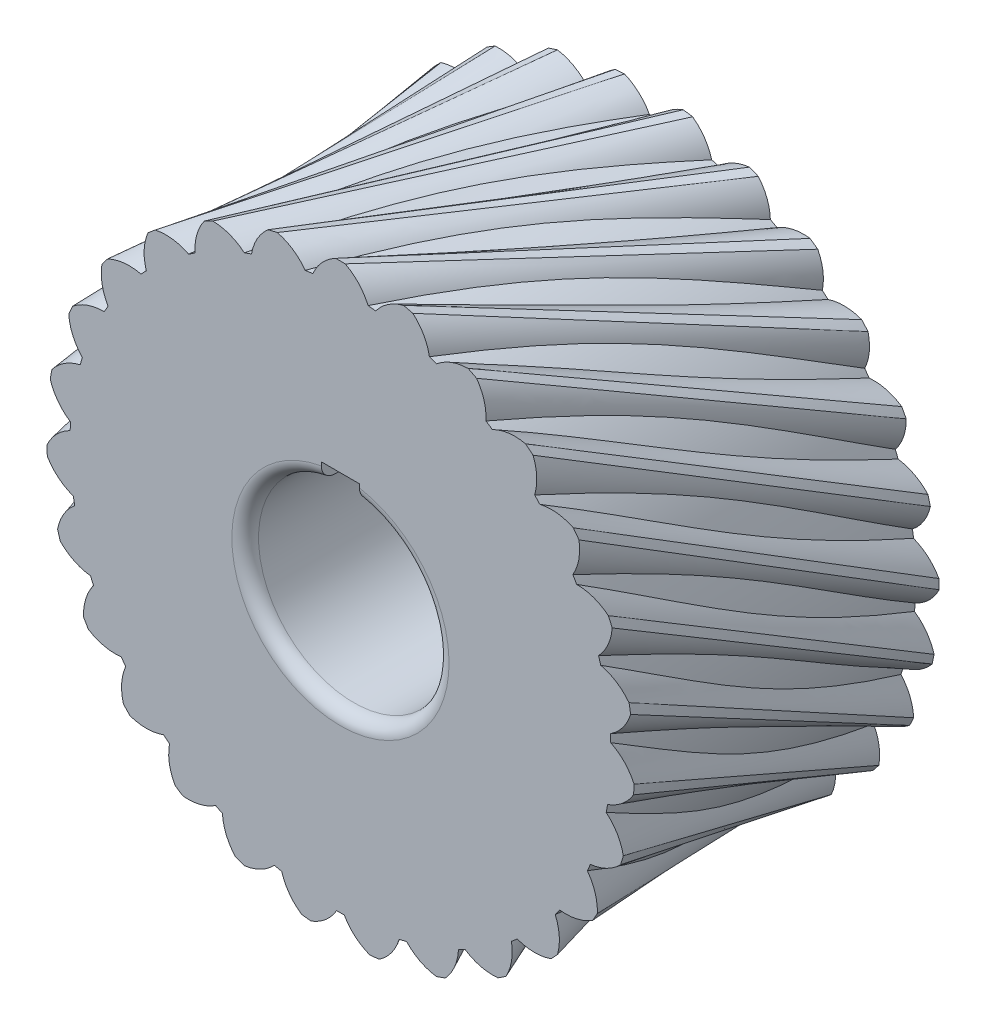
from build123d import *

# Parameters (mm, degrees)
ESQUISSE5_R                  = 14.2
ESQUISSE5_R_2                = 5
EXTRUSION1_DEPTH             = 16
R_P_TITION_CIRCULAIRE2_COUNT = 27
ESQUISSE7_W                  = 2
ESQUISSE7_H                  = 2.243921676
ENL_V_MAT_EXTRU_1_DEPTH      = 28.051779314
CONG_1_R                     = 0.7
CHANFREIN1_SIZE              = 0.5


with BuildPart() as part:
    # Esquisse5 → Extrusion1 (new body)
    with BuildSketch(Plane.XY):
        Circle(ESQUISSE5_R)
        Circle(ESQUISSE5_R_2, mode=Mode.SUBTRACT)
    extrude(amount=-EXTRUSION1_DEPTH)

    # Esquisse1 for Lissage3 → Lissage3 section 0
    with BuildSketch(Plane.XY):
        with BuildLine():
            # circular arc as an exact rational Bezier (weights 1, cos(half-angle), 1)
            Bezier((-0.25, 15.422600681), (0, 15.426653176), (0.25, 15.422600681), weights=[1, 0.999868644, 1])
            Bezier((0.25, 15.422600681), (1.08257531, 14.989397783), (1.45, 14.125774315), weights=[1, 0.941281609, 1])
            Bezier((1.45, 14.125774315), (0, 14.274615713), (-1.45, 14.125774315), weights=[1, 0.994772839, 1])
            Bezier((-1.45, 14.125774315), (-1.08257531, 14.989397783), (-0.25, 15.422600681), weights=[1, 0.941281609, 1])
        make_face()
    # Esquisse6 for Lissage3 → Lissage3 section 1
    with BuildSketch(Plane(origin=(0, 0, -16), x_dir=(-1, 0, 0), z_dir=(0, 0, -1))):
        with BuildLine():
            Bezier((-8.641252327, 12.776848985), (-8.848364753, 12.636774485), (-9.050828349, 12.490060767), weights=[1, 0.999868644, 1])
            Bezier((-9.050828349, 12.490060767), (-9.484359141, 11.657656148), (-9.289981757, 10.739471075), weights=[1, 0.941281609, 1])
            Bezier((-9.289981757, 10.739471075), (-8.187583211, 11.693080643), (-6.914440828, 12.40284274), weights=[1, 0.994772839, 1])
            Bezier((-6.914440828, 12.40284274), (-7.710771585, 12.899535525), (-8.641252327, 12.776848985), weights=[1, 0.941281609, 1])
        make_face()
    lissage3 = loft()

    # Répétition circulaire2: Lissage3 ×27 about axis
    r_p_tition_circulaire2_axis = Axis((0, 0, -16), (0, 0, 1))
    for i in range(1, R_P_TITION_CIRCULAIRE2_COUNT):
        add(lissage3.rotate(r_p_tition_circulaire2_axis, i * 360 / R_P_TITION_CIRCULAIRE2_COUNT))

    # Esquisse7 → Enlèv. mat.-Extru.1 (cut, through all)
    with BuildSketch(Plane.XY):
        with Locations((0, 4.678039162)):
            Rectangle(ESQUISSE7_W, ESQUISSE7_H)
    extrude(amount=-ENL_V_MAT_EXTRU_1_DEPTH, mode=Mode.SUBTRACT)

    # Congé1
    cong_1_edges = [part.edges().sort_by_distance(p)[0] for p in [
        (0, -5, 0),
    ]]
    fillet(cong_1_edges, radius=CONG_1_R)

    # Chanfrein1
    chanfrein1_edges = [part.edges().sort_by_distance(p)[0] for p in [
        (0, -5, -16),
    ]]
    chamfer(chanfrein1_edges, length=CHANFREIN1_SIZE)


solid = part.part
